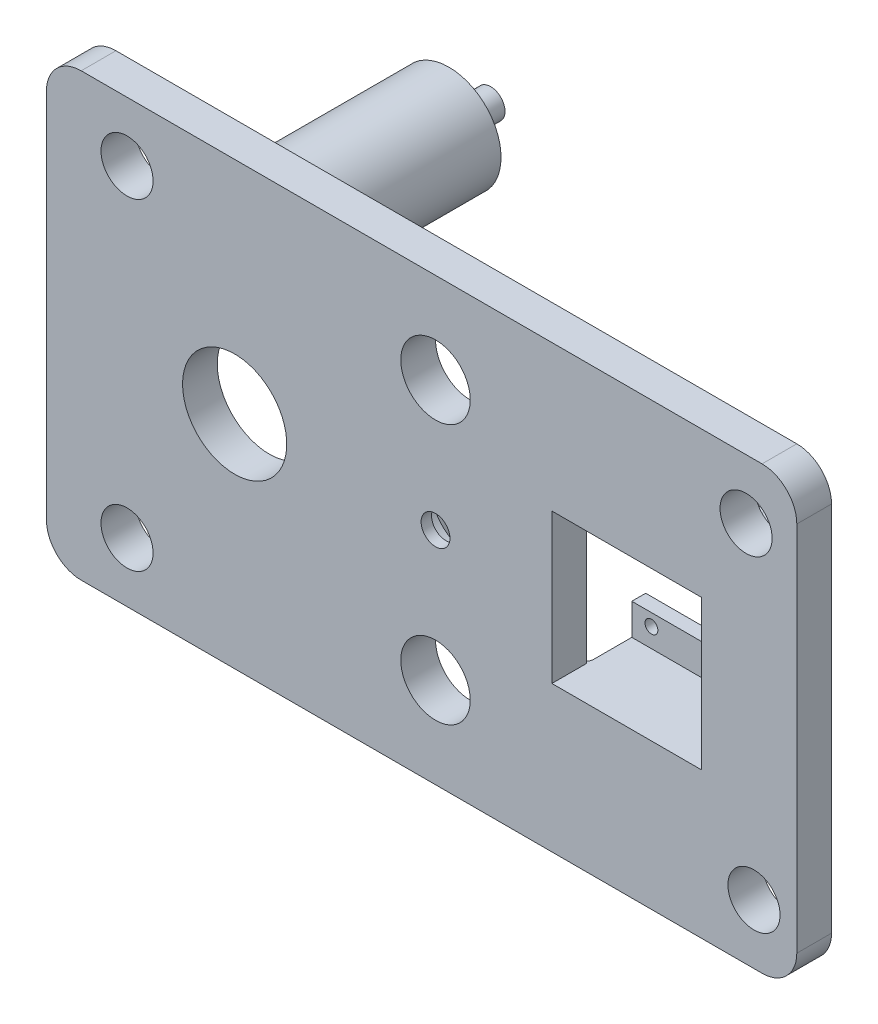
from build123d import *

# Parameters (mm, degrees)
SKETCH1_W            = 216
SKETCH1_H            = 127
BOSS_EXTRUDE1_DEPTH  = 10
FILLET1_R            = 10
FILLET2_R            = 10
SKETCH9_R            = 11.35
CUT_EXTRUDE4_DEPTH   = 7
SKETCH12_R           = 4.15
CUT_EXTRUDE5_DEPTH   = 7
SKETCH9_4_W          = 43
SKETCH9_4_H          = 43
CUT_EXTRUDE6_DEPTH   = 126.683133315
SKETCH13_W           = 43
SKETCH13_H           = 4
BOSS_EXTRUDE2_DEPTH  = 17
FILLET4_R            = 2
SKETCH17_W           = 43
SKETCH17_H           = 4
BOSS_EXTRUDE5_DEPTH  = 9
SKETCH18_W           = 43
SKETCH18_H           = 4
BOSS_EXTRUDE6_DEPTH  = 17
SKETCH19_W           = 43
SKETCH19_H           = 4
BOSS_EXTRUDE7_DEPTH  = 9
FILLET5_R            = 2
SKETCH20_R           = 1.85
CUT_EXTRUDE7_DEPTH   = 9
SKETCH23_R           = 1.85
CUT_EXTRUDE8_DEPTH   = 9
SKETCH25_R           = 15
BOSS_EXTRUDE9_DEPTH  = 48.84
SKETCH26_R           = 4.15
BOSS_EXTRUDE10_DEPTH = 12
SKETCH27_R           = 4.15
BOSS_EXTRUDE11_DEPTH = 12
FILLET9_R            = 2
FILLET10_R           = 2
SKETCH28_R           = 7.5
CUT_EXTRUDE9_DEPTH   = 144.925521017
SKETCH29_R           = 10
SKETCH29_R_2         = 15
CUT_EXTRUDE10_DEPTH  = 140.275825612


with BuildPart() as part:
    # Sketch1 → Boss-Extrude1 (new body)
    with BuildSketch(Plane.XY):
        Rectangle(SKETCH1_W, SKETCH1_H)
    extrude(amount=BOSS_EXTRUDE1_DEPTH)

    # Fillet1
    fillet1_edges = [part.edges().sort_by_distance(p)[0] for p in [
        (-108, 63.5, 5),
    ]]
    fillet(fillet1_edges, radius=FILLET1_R)

    # Fillet2
    fillet2_edges = [part.edges().sort_by_distance(p)[0] for p in [
        (-108, -63.5, 5),
        (108, 63.5, 5),
        (108, -63.5, 5),
    ]]
    fillet(fillet2_edges, radius=FILLET2_R)

    # Sketch9 → Cut-Extrude4 (cut)
    with BuildSketch(Plane(origin=(0, 0, 0), x_dir=(-1, 0, 0), z_dir=(0, 0, -1))):
        with Locations((-4, 0)):
            Circle(SKETCH9_R)
    extrude(amount=-CUT_EXTRUDE4_DEPTH, mode=Mode.SUBTRACT)

    # Sketch12 → Cut-Extrude5 (cut)
    with BuildSketch(Plane(origin=(0, 0, 7), x_dir=(-1, 0, 0), z_dir=(0, 0, -1))):
        with Locations((-4, 0)):
            Circle(SKETCH12_R)
    extrude(amount=-CUT_EXTRUDE5_DEPTH, mode=Mode.SUBTRACT)

    # Sketch9<4> → Cut-Extrude6 (cut, through all)
    with BuildSketch(Plane(origin=(0, 0, 0), x_dir=(-1, 0, 0), z_dir=(0, 0, -1))):
        with Locations((-59, 0)):
            Rectangle(SKETCH9_4_W, SKETCH9_4_H)
    extrude(amount=-CUT_EXTRUDE6_DEPTH, mode=Mode.SUBTRACT)

    # Sketch13 → Boss-Extrude2 (add)
    with BuildSketch(Plane(origin=(0, 0, 0), x_dir=(-1, 0, 0), z_dir=(0, 0, -1))):
        with Locations((-59, -23.5)):
            Rectangle(SKETCH13_W, SKETCH13_H)
    extrude(amount=BOSS_EXTRUDE2_DEPTH)

    # Fillet4
    fillet4_edges = [part.edges().sort_by_distance(p)[0] for p in [
        (59, -25.5, 0),
        (37.5, -23.5, 0),
        (80.5, -23.5, 0),
    ]]
    fillet(fillet4_edges, radius=FILLET4_R)

    # Sketch17 → Boss-Extrude5 (add)
    with BuildSketch(Plane(origin=(0, -21.5, 0), x_dir=(1, 0, 0), z_dir=(0, 1, 0))):
        with Locations((59, 15)):
            Rectangle(SKETCH17_W, SKETCH17_H)
    extrude(amount=BOSS_EXTRUDE5_DEPTH)

    # Sketch18 → Boss-Extrude6 (add)
    with BuildSketch(Plane(origin=(0, 0, 0), x_dir=(-1, 0, 0), z_dir=(0, 0, -1))):
        with Locations((-59, 23.5)):
            Rectangle(SKETCH18_W, SKETCH18_H)
    extrude(amount=BOSS_EXTRUDE6_DEPTH)

    # Sketch19 → Boss-Extrude7 (add)
    with BuildSketch(Plane(origin=(0, 21.5, 0), x_dir=(-1, 0, 0), z_dir=(0, -1, 0))):
        with Locations((-59, 15)):
            Rectangle(SKETCH19_W, SKETCH19_H)
    extrude(amount=BOSS_EXTRUDE7_DEPTH)

    # Fillet5
    fillet5_edges = [part.edges().sort_by_distance(p)[0] for p in [
        (37.5, 23.5, 0),
        (80.5, 23.5, 0),
        (59, 25.5, 0),
    ]]
    fillet(fillet5_edges, radius=FILLET5_R)

    # Sketch20 → Cut-Extrude7 (cut)
    with BuildSketch(Plane(origin=(0, 0, -17), x_dir=(-1, 0, 0), z_dir=(0, 0, -1))):
        with Locations((-43.15, -16)):
            Circle(SKETCH20_R)
        with Locations((-74.85, -16)):
            Circle(SKETCH20_R)
    extrude(amount=-CUT_EXTRUDE7_DEPTH, mode=Mode.SUBTRACT)

    # Sketch23 → Cut-Extrude8 (cut)
    with BuildSketch(Plane(origin=(0, 0, -17), x_dir=(-1, 0, 0), z_dir=(0, 0, -1))):
        with Locations((-43.15, 15.85)):
            Circle(SKETCH23_R)
        with Locations((-74.85, 16)):
            Circle(SKETCH23_R)
    extrude(amount=-CUT_EXTRUDE8_DEPTH, mode=Mode.SUBTRACT)

    # Sketch25 → Boss-Extrude9 (add)
    with BuildSketch(Plane(origin=(0, 0, 0), x_dir=(-1, 0, 0), z_dir=(0, 0, -1))):
        with Locations((50.981638517, -43.5)):
            Circle(SKETCH25_R)
        with Locations((50.981638517, 43.5)):
            Circle(SKETCH25_R)
    extrude(amount=BOSS_EXTRUDE9_DEPTH)

    # Sketch26 → Boss-Extrude10 (add)
    with BuildSketch(Plane(origin=(0, 0, -48.84), x_dir=(-1, 0, 0), z_dir=(0, 0, -1))):
        with Locations((50.981638517, -43.5)):
            Circle(SKETCH26_R)
    extrude(amount=BOSS_EXTRUDE10_DEPTH)

    # Sketch27 → Boss-Extrude11 (add)
    with BuildSketch(Plane(origin=(0, 0, -48.84), x_dir=(-1, 0, 0), z_dir=(0, 0, -1))):
        with Locations((50.981638517, 43.5)):
            Circle(SKETCH27_R)
    extrude(amount=BOSS_EXTRUDE11_DEPTH)

    # Fillet9
    fillet9_edges = [part.edges().sort_by_distance(p)[0] for p in [
        (-35.981638517, -43.5, 0),
    ]]
    fillet(fillet9_edges, radius=FILLET9_R)

    # Fillet10
    fillet10_edges = [part.edges().sort_by_distance(p)[0] for p in [
        (-35.981638517, 43.5, 0),
    ]]
    fillet(fillet10_edges, radius=FILLET10_R)

    # Sketch28 → Cut-Extrude9 (cut, through all)
    with BuildSketch(Plane.XY.offset(10)):
        with Locations((-84.811667967, 46.37)):
            Circle(SKETCH28_R)
        with Locations((-84.811667967, -46.37)):
            Circle(SKETCH28_R)
        with Locations((95.674047271, -46.369786546)):
            Circle(SKETCH28_R)
        with Locations((93.399057455, 46.37)):
            Circle(SKETCH28_R)
    extrude(amount=-CUT_EXTRUDE9_DEPTH, mode=Mode.SUBTRACT)

    # Sketch29 → Cut-Extrude10 (cut, through all)
    with BuildSketch(Plane(origin=(0, 0, 0), x_dir=(-1, 0, 0), z_dir=(0, 0, -1))):
        with Locations((-4, 37.425)):
            Circle(SKETCH29_R)
        with Locations((53.828265838, 0)):
            Circle(SKETCH29_R_2)
        with Locations((-4, -37.425)):
            Circle(SKETCH29_R)
    extrude(amount=-CUT_EXTRUDE10_DEPTH, mode=Mode.SUBTRACT)


solid = part.part
